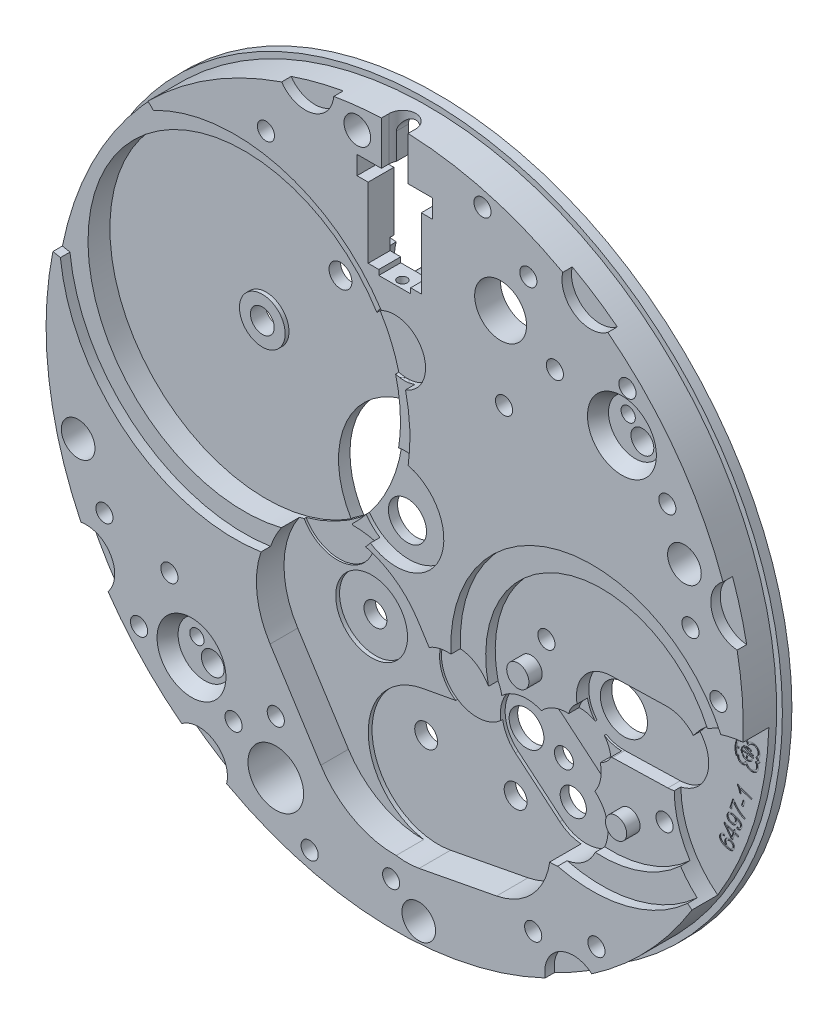
from build123d import *
from OCP.BRepFilletAPI import BRepFilletAPI_MakeChamfer

# Parameters (mm, degrees)
SKETCH2_R           = 18.6
BOSS_EXTRUDE1_DEPTH = 2.25
SKETCH3_OUTSIDE_W   = 49.732
SKETCH3_OUTSIDE_H   = 49.732
SKETCH3_OUTSIDE_R   = 18.3
CUT_EXTRUDE1_DEPTH  = 1.75
CUT_EXTRUDE2_DEPTH  = 1.1
SKETCH41_R          = 0.7
BOSS_EXTRUDE7_DEPTH = 1.1
CUT_EXTRUDE3_DEPTH  = 0.9
SKETCH7_R           = 1.785
CUT_EXTRUDE4_DEPTH  = 0.5
SKETCH12_R          = 2.139
CUT_EXTRUDE8_DEPTH  = 1
SKETCH39_R          = 0.7
BOSS_EXTRUDE5_DEPTH = 1
SKETCH13_R          = 4.396
CUT_EXTRUDE9_DEPTH  = 0.9
SKETCH40_R          = 0.39
BOSS_EXTRUDE6_DEPTH = 0.9
SKETCH14_R          = 0.7
CUT_EXTRUDE10_DEPTH = 0.5
SKETCH15_R          = 4.6
CUT_EXTRUDE11_DEPTH = 0.5
CUT_EXTRUDE19_REACH = 28.4
SKETCH27_R          = 1.286
CUT_EXTRUDE22_DEPTH = 0.9
SKETCH33_R          = 1.275
CUT_EXTRUDE27_DEPTH = 0.7
CUT_EXTRUDE28_REACH = 28.4
SKETCH34_R          = 0.375
SKETCH36_R          = 0.75
BOSS_EXTRUDE4_DEPTH = 0.9
SKETCH37_R          = 0.739
CUT_EXTRUDE29_DEPTH = 1
CUT_EXTRUDE30_REACH = 28.4
SKETCH38_R          = 0.45
SKETCH45_R          = 2.089
CUT_EXTRUDE33_DEPTH = 0.6
CUT_EXTRUDE5_DEPTH  = 1.65
CUT_EXTRUDE6_DEPTH  = 1.65
SKETCH11_R          = 5.024
CUT_EXTRUDE7_DEPTH  = 1.35
SKETCH16_R          = 6.087
CUT_EXTRUDE12_DEPTH = 1
SKETCH21_R          = 1.202
CUT_EXTRUDE16_DEPTH = 1.55
SKETCH18_R          = 8.2
CUT_EXTRUDE13_DEPTH = 1.65
CUT_EXTRUDE31_REACH = 28.4
CUT_EXTRUDE14_DEPTH = 0.5
CUT_EXTRUDE15_DEPTH = 1.45
SKETCH22_R          = 1.87
CUT_EXTRUDE17_DEPTH = 1.55
SKETCH23_R          = 7.42
CUT_EXTRUDE18_DEPTH = 0.5
CUT_EXTRUDE20_START = 15.997
CUT_EXTRUDE20_DEPTH = 2.303
CUT_EXTRUDE21_DEPTH = 1.8
CUT_EXTRUDE23_REACH = 28.4
SKETCH28_R          = 1
SKETCH29_R          = 1.5
CUT_EXTRUDE24_DEPTH = 0.5
SKETCH30_R          = 2
CUT_EXTRUDE25_DEPTH = 1.55
SKETCH31_R          = 1.2
BOSS_EXTRUDE2_DEPTH = 0.2
SKETCH32_R          = 1.405
CUT_EXTRUDE26_DEPTH = 0.7
CHAMFER1_SIZE       = 0.404
CHAMFER1_SIZE_2     = 0.7
SKETCH35_R          = 0.5815
SKETCH35_R_2        = 0.558
BOSS_EXTRUDE3_DEPTH = 0.7
SKETCH48_R          = 2.5
SKETCH48_R_2        = 1.62
CUT_EXTRUDE37_DEPTH = 0.67
SKETCH43_R          = 1.362
SKETCH43_R_2        = 0.45
SKETCH43_R_3        = 0.7
SKETCH43_R_4        = 0.625
SKETCH43_R_5        = 0.912
SKETCH43_R_6        = 0.6875
SKETCH43_R_7        = 1.2365
SKETCH43_R_8        = 1.461
SKETCH43_R_9        = 1
CUT_EXTRUDE32_DEPTH = 27.400426141
SKETCH44_R          = 0.884
SKETCH44_R_2        = 0.6
SKETCH44_R_3        = 0.5
CUT_EXTRUDE34_DEPTH = 27.400426141
CHAMFER2_SIZE       = 0.7
CHAMFER3_SIZE       = 0.7
SKETCH46_R          = 0.45
CUT_EXTRUDE35_DEPTH = 27.400426141
SKETCH47_R          = 0.65
CUT_EXTRUDE36_DEPTH = 0.5
SKETCH50_R          = 0.25
CUT_EXTRUDE38_DEPTH = 4.608
SKETCH51_R          = 0.6
CUT_EXTRUDE39_DEPTH = 27.400426141
SKETCH52_R          = 1.884
CUT_EXTRUDE40_DEPTH = 1.65
CUT_EXTRUDE41_REACH = 28.342
BOSS_EXTRUDE8_DEPTH = 0.05
CUT_EXTRUDE42_REACH = 28.342
CUT_EXTRUDE43_REACH = 28.342
CUT_EXTRUDE44_REACH = 28.342
CUT_EXTRUDE45_DEPTH = 0.05


with BuildPart() as part:
    # Sketch2 → Boss-Extrude1 (new body)
    with BuildSketch(Plane.XY):
        Circle(SKETCH2_R)
    extrude(amount=-BOSS_EXTRUDE1_DEPTH)

    # Sketch3 outside → Cut-Extrude1 (cut)
    with BuildSketch(Plane.XY):
        Rectangle(SKETCH3_OUTSIDE_W, SKETCH3_OUTSIDE_H)
        Circle(SKETCH3_OUTSIDE_R, mode=Mode.SUBTRACT)
    extrude(amount=-CUT_EXTRUDE1_DEPTH, mode=Mode.SUBTRACT)

    # Sketch5 → Cut-Extrude2 (cut)
    with BuildSketch(Plane(origin=(0, 0, -2.25), x_dir=(-1, 0, 0), z_dir=(0, 0, -1))):
        with BuildLine():
            Line((-0.625, 17.375), (-0.625, 11.941))
            Line((-0.625, 11.941), (-1.393240826, 11.941))
            ThreePointArc((-1.393240826, 11.941), (0, 7.897), (1.393240826, 11.941))
            Line((1.393240826, 11.941), (0.625, 11.941))
            Line((0.625, 11.941), (0.625, 17.375))
            ThreePointArc((0.625, 17.375), (0, 18), (-0.625, 17.375))
        make_face()
    extrude(amount=-CUT_EXTRUDE2_DEPTH, mode=Mode.SUBTRACT)

    # Sketch41 → Boss-Extrude7 (add)
    with BuildSketch(Plane(origin=(0, 0, -1.15), x_dir=(-1, 0, 0), z_dir=(0, 0, -1))):
        with Locations((0, 10.159)):
            Circle(SKETCH41_R)
    extrude(amount=BOSS_EXTRUDE7_DEPTH)

    # Sketch6 → Cut-Extrude3 (cut)
    with BuildSketch(Plane(origin=(0, 0, -2.25), x_dir=(-1, 0, 0), z_dir=(0, 0, -1))):
        with BuildLine():
            Line((-2.076890078, 15.421423569), (-5.927172387, 13.552408211))
            ThreePointArc((-5.927172387, 13.552408211), (-6.035449278, 14.182114052), (-6.291785685, 14.767387473))
            ThreePointArc((-6.291785685, 14.767387473), (-7.133886391, 14.194789294), (-7.748340733, 15.006853415))
            ThreePointArc((-7.748340733, 15.006853415), (-10.14098996, 14.254732917), (-9.41173086, 11.855016948))
            ThreePointArc((-9.41173086, 11.855016948), (-10.4299638, 9.379413114), (-7.917626481, 8.455522506))
            Line((-7.917626481, 8.455522506), (-0.737336458, 11.941))
            Line((-0.737336458, 11.941), (0.422162218, 11.941))
            ThreePointArc((0.422162218, 11.941), (1.70564449, 10.838656818), (3.338835421, 11.280442527))
            ThreePointArc((3.338835421, 11.280442527), (4.540703411, 12.185954627), (5.905433906, 12.819949505))
            ThreePointArc((5.905433906, 12.819949505), (6.700320393, 13.301781919), (7.221300042, 14.07157878))
            ThreePointArc((7.221300042, 14.07157878), (7.507306005, 14.567751633), (7.362177948, 15.121759538))
            ThreePointArc((7.362177948, 15.121759538), (6.983377806, 16.123181813), (6.172512816, 16.822348523))
            ThreePointArc((6.172512816, 16.822348523), (3.717993414, 17.734315655), (1.125774471, 18.104113573))
            ThreePointArc((1.125774471, 18.104113573), (0.264750255, 18.014470296), (-0.538988303, 17.69290701))
            ThreePointArc((-0.538988303, 17.69290701), (-2.392928729, 17.291754548), (-2.076890078, 15.421423569))
        make_face()
    extrude(amount=-CUT_EXTRUDE3_DEPTH, mode=Mode.SUBTRACT)

    # Sketch7 → Cut-Extrude4 (cut)
    with BuildSketch(Plane(origin=(0, 0, -2.25), x_dir=(-1, 0, 0), z_dir=(0, 0, -1))):
        with Locations((-10.179, 11.074)):
            Circle(SKETCH7_R)
    extrude(amount=-CUT_EXTRUDE4_DEPTH, mode=Mode.SUBTRACT)

    # Sketch12 → Cut-Extrude8 (cut)
    with BuildSketch(Plane(origin=(0, 0, -2.25), x_dir=(-1, 0, 0), z_dir=(0, 0, -1))):
        with Locations((-2.56, 7.678)):
            Circle(SKETCH12_R)
    extrude(amount=-CUT_EXTRUDE8_DEPTH, mode=Mode.SUBTRACT)

    # Sketch39 → Boss-Extrude5 (add)
    with BuildSketch(Plane(origin=(0, 0, -1.25), x_dir=(-1, 0, 0), z_dir=(0, 0, -1))):
        with Locations(Location((-2.56, 7.678, 0), (0, 0, 180))):
            Circle(SKETCH39_R)
    extrude(amount=BOSS_EXTRUDE5_DEPTH)

    # Sketch13 → Cut-Extrude9 (cut)
    with BuildSketch(Plane(origin=(0, 0, -2.25), x_dir=(-1, 0, 0), z_dir=(0, 0, -1))):
        with Locations((-4.61, 2.397)):
            Circle(SKETCH13_R)
    extrude(amount=-CUT_EXTRUDE9_DEPTH, mode=Mode.SUBTRACT)

    # Sketch40 → Boss-Extrude6 (add)
    with BuildSketch(Plane(origin=(0, 0, -1.35), x_dir=(-1, 0, 0), z_dir=(0, 0, -1))):
        with Locations((-4.61, 2.397)):
            Circle(SKETCH40_R)
    extrude(amount=BOSS_EXTRUDE6_DEPTH)

    # Sketch14 → Cut-Extrude10 (cut)
    with BuildSketch(Plane(origin=(0, 0, -2.25), x_dir=(-1, 0, 0), z_dir=(0, 0, -1))):
        with BuildLine():
            Line((-3.076249804, 10.805637807), (-1.90914891, 11.372175354))
            ThreePointArc((-1.90914891, 11.372175354), (-2.122650137, 10.940665144), (-2.239995369, 10.473745524))
            ThreePointArc((-2.239995369, 10.473745524), (0.243499976, 7.435134023), (-2.725542979, 4.86887353))
            ThreePointArc((-2.725542979, 4.86887353), (-8.591624788, 5.723803536), (-6.589517741, 11.303533679))
            ThreePointArc((-6.589517741, 11.303533679), (-7.667655819, 12.642680547), (-7.481667895, 14.351804456))
            ThreePointArc((-7.481667895, 14.351804456), (-6.517059725, 14.377034404), (-6.399706667, 15.334809812))
            ThreePointArc((-6.399706667, 15.334809812), (-3.533544819, 14.328146092), (-4.296817174, 11.387793919))
            ThreePointArc((-4.296817174, 11.387793919), (-3.660629892, 11.151026184), (-3.076249804, 10.805637807))
        make_face()
        with Locations(Location((-2.56, 7.678, 0), (0, 0, 180))):
            Circle(SKETCH14_R, mode=Mode.SUBTRACT)
    extrude(amount=-CUT_EXTRUDE10_DEPTH, mode=Mode.SUBTRACT)

    # Sketch15 → Cut-Extrude11 (cut)
    with BuildSketch(Plane(origin=(0, 0, -2.25), x_dir=(-1, 0, 0), z_dir=(0, 0, -1))):
        Circle(SKETCH15_R)
    extrude(amount=-CUT_EXTRUDE11_DEPTH, mode=Mode.SUBTRACT)

    # Sketch24 → Cut-Extrude19 (cut, up to next)
    with BuildSketch(Plane(origin=(0, 0, -2.25), x_dir=(-1, 0, 0), z_dir=(0, 0, -1)), mode=Mode.PRIVATE) as cut_extrude19_sk1:
        with BuildLine():
            Line((-0.625, 17.375), (-0.625, 15.997))
            Line((-0.625, 15.997), (-1.9775, 15.997))
            Line((-1.9775, 15.997), (-1.9775, 15.026))
            Line((-1.9775, 15.026), (-1.3935, 15.026))
            Line((-1.3935, 15.026), (-1.3935, 11.336))
            Line((-1.3935, 11.336), (-0.8345, 11.336))
            Line((-0.8345, 11.336), (-0.8345, 11.064))
            Line((-0.8345, 11.064), (0.8345, 11.064))
            Line((0.8345, 11.064), (0.8345, 11.336))
            Line((0.8345, 11.336), (1.3935, 11.336))
            Line((1.3935, 11.336), (1.3935, 15.026))
            Line((1.3935, 15.026), (1.9775, 15.026))
            Line((1.9775, 15.026), (1.9775, 15.997))
            Line((1.9775, 15.997), (0.625, 15.997))
            Line((0.625, 15.997), (0.625, 17.375))
            ThreePointArc((0.625, 17.375), (0, 18), (-0.625, 17.375))
        make_face()
    cut_extrude19_tool1 = extrude(cut_extrude19_sk1.sketch, amount=-CUT_EXTRUDE19_REACH, mode=Mode.PRIVATE) & part.part
    add(cut_extrude19_tool1.solids().sort_by_distance((0, 14.175659, -2.25))[0], mode=Mode.SUBTRACT)

    # Sketch27 → Cut-Extrude22 (cut)
    with BuildSketch(Plane(origin=(0, 0, -2.25), x_dir=(-1, 0, 0), z_dir=(0, 0, -1))):
        with Locations((-5.514, 13.273)):
            Circle(SKETCH27_R)
    extrude(amount=-CUT_EXTRUDE22_DEPTH, mode=Mode.SUBTRACT)

    # Sketch33 → Cut-Extrude27 (cut)
    with BuildSketch(Plane(origin=(0, 0, -2.25), x_dir=(-1, 0, 0), z_dir=(0, 0, -1))):
        with Locations((-11.554, 10.605)):
            Circle(SKETCH33_R)
        with Locations((11.084, -10.828)):
            Circle(SKETCH33_R)
    extrude(amount=-CUT_EXTRUDE27_DEPTH, mode=Mode.SUBTRACT)

    # Sketch34 → Cut-Extrude28 (cut, up to next)
    with BuildSketch(Plane(origin=(0, 0, -2.25), x_dir=(-1, 0, 0), z_dir=(0, 0, -1)), mode=Mode.PRIVATE) as cut_extrude28_sk1:
        with Locations((-11.554, 10.605)):
            Circle(SKETCH34_R)
    cut_extrude28_tool1 = extrude(cut_extrude28_sk1.sketch, amount=-CUT_EXTRUDE28_REACH, mode=Mode.PRIVATE) & part.part
    # Sketch34 → Cut-Extrude28 (cut, up to next)
    with BuildSketch(Plane(origin=(0, 0, -2.25), x_dir=(-1, 0, 0), z_dir=(0, 0, -1)), mode=Mode.PRIVATE) as cut_extrude28_sk2:
        with Locations((11.084, -10.828)):
            Circle(SKETCH34_R)
    cut_extrude28_tool2 = extrude(cut_extrude28_sk2.sketch, amount=-CUT_EXTRUDE28_REACH, mode=Mode.PRIVATE) & part.part
    add(cut_extrude28_tool1.solids().sort_by_distance((11.554, 10.605, -2.25))[0], mode=Mode.SUBTRACT)
    add(cut_extrude28_tool2.solids().sort_by_distance((-11.084, -10.828, -2.25))[0], mode=Mode.SUBTRACT)

    # Sketch36 → Boss-Extrude4 (add)
    with BuildSketch(Plane(origin=(0, 0, -2.25), x_dir=(-1, 0, 0), z_dir=(0, 0, -1))):
        with Locations((-8.565, 13.423)):
            Circle(SKETCH36_R)
    extrude(amount=-BOSS_EXTRUDE4_DEPTH)

    # Sketch37 → Cut-Extrude29 (cut)
    with BuildSketch(Plane(origin=(0, 0, -2.25), x_dir=(-1, 0, 0), z_dir=(0, 0, -1))):
        with Locations((-7.014, 14.924)):
            Circle(SKETCH37_R)
    extrude(amount=-CUT_EXTRUDE29_DEPTH, mode=Mode.SUBTRACT)

    # Sketch38 → Cut-Extrude30 (cut, up to next)
    with BuildSketch(Plane(origin=(0, 0, -2.25), x_dir=(-1, 0, 0), z_dir=(0, 0, -1)), mode=Mode.PRIVATE) as cut_extrude30_sk1:
        with Locations((-7.014, 14.924)):
            Circle(SKETCH38_R)
    cut_extrude30_tool1 = extrude(cut_extrude30_sk1.sketch, amount=-CUT_EXTRUDE30_REACH, mode=Mode.PRIVATE) & part.part
    add(cut_extrude30_tool1.solids().sort_by_distance((7.014, 14.924, -2.25))[0], mode=Mode.SUBTRACT)

    # Sketch45 → Cut-Extrude33 (cut)
    with BuildSketch(Plane(origin=(0, 0, -1.75), x_dir=(-1, 0, 0), z_dir=(0, 0, -1))):
        with Locations((0.232, 0.114)):
            Circle(SKETCH45_R)
    extrude(amount=-CUT_EXTRUDE33_DEPTH, mode=Mode.SUBTRACT)

    # Sketch9 → Cut-Extrude5 (cut)
    with BuildSketch(Plane.XY):
        with BuildLine():
            Line((1.28197439, -14.832200316), (5.34897439, -14.054200316))
            ThreePointArc((5.34897439, -14.054200316), (7.104703788, -13.144772192), (8.078658765, -11.424))
            ThreePointArc((8.078658765, -11.424), (8.110145994, -11.271567283), (8.134765721, -11.117875879))
            ThreePointArc((8.134765721, -11.117875879), (10.054091894, -9.912691286), (9.511131814, -7.712355582))
            ThreePointArc((9.511131814, -7.712355582), (9.80536714, -7.021819052), (9.793277303, -6.271306586))
            ThreePointArc((9.793277303, -6.271306586), (9.236753092, -5.252231098), (8.139268411, -4.873072265))
            ThreePointArc((8.139268411, -4.873072265), (7.355220259, -5.002491984), (6.702735397, -5.456082629))
            ThreePointArc((6.702735397, -5.456082629), (5.608858257, -5.321849251), (4.619263756, -5.806914735))
            ThreePointArc((4.619263756, -5.806914735), (3.802175085, -7.685286504), (1.753783598, -7.68787791))
            Line((1.753783598, -7.68787791), (0, -8.011669418))
            ThreePointArc((0, -8.011669418), (-2.780283148, -12.064990522), (1.28197439, -14.832200316))
        make_face()
    extrude(amount=-CUT_EXTRUDE5_DEPTH, mode=Mode.SUBTRACT)

    # Sketch10 → Cut-Extrude6 (cut)
    with BuildSketch(Plane.XY):
        with BuildLine():
            Line((10.429783108, -5.725354257), (13.337783108, -5.648354257))
            ThreePointArc((13.337783108, -5.648354257), (15.131354257, -3.757216892), (13.240216892, -1.963645743))
            Line((13.240216892, -1.963645743), (10.332216892, -2.040645743))
            ThreePointArc((10.332216892, -2.040645743), (8.538645743, -3.931783108), (10.429783108, -5.725354257))
        make_face()
    extrude(amount=-CUT_EXTRUDE6_DEPTH, mode=Mode.SUBTRACT)

    # Sketch11 → Cut-Extrude7 (cut)
    with BuildSketch(Plane.XY):
        with Locations((18.697, -5.603)):
            Circle(SKETCH11_R)
    extrude(amount=-CUT_EXTRUDE7_DEPTH, mode=Mode.SUBTRACT)

    # Sketch16 → Cut-Extrude12 (cut)
    with BuildSketch(Plane.XY):
        with Locations((10.363, -3.905)):
            Circle(SKETCH16_R)
    extrude(amount=-CUT_EXTRUDE12_DEPTH, mode=Mode.SUBTRACT)

    # Sketch21 → Cut-Extrude16 (cut)
    with BuildSketch(Plane.XY):
        with Locations((9.294, -5.176)):
            Circle(SKETCH21_R)
    extrude(amount=-CUT_EXTRUDE16_DEPTH, mode=Mode.SUBTRACT)

    # Sketch18 → Cut-Extrude13 (cut)
    with BuildSketch(Plane.XY):
        with Locations((-8.4, 4.5)):
            Circle(SKETCH18_R)
    extrude(amount=-CUT_EXTRUDE13_DEPTH, mode=Mode.SUBTRACT)

    # Sketch42 → Cut-Extrude31 (cut, up to next)
    with BuildSketch(Plane.XY, mode=Mode.PRIVATE) as cut_extrude31_sk1:
        with BuildLine():
            ThreePointArc((-3.937004344, -2.379074776), (-1.171864246, 0.627784417), (-0.200557598, 4.595625817))
            ThreePointArc((-0.200557598, 4.595625817), (-4.054807862, 2.172218498), (-3.937004344, -2.379074776))
        make_face()
    cut_extrude31_tool1 = extrude(cut_extrude31_sk1.sketch, amount=-CUT_EXTRUDE31_REACH, mode=Mode.PRIVATE) & part.part
    add(cut_extrude31_tool1.solids().sort_by_distance((-2.52901, 1.354827, 0))[0], mode=Mode.SUBTRACT)

    # Sketch19 → Cut-Extrude14 (cut)
    with BuildSketch(Plane.XY):
        with BuildLine():
            Line((-12.949749453, 12.930351468), (-12.668984942, 12.649586957))
            ThreePointArc((-12.668984942, 12.649586957), (-0.28543724, 0.16481013), (-17.547453856, 3.518120199))
            Line((-17.547453856, 3.518120199), (-17.942782165, 3.598133986))
            ThreePointArc((-17.942782165, 3.598133986), (-16.13566541, 8.633093407), (-12.949749453, 12.930351468))
        make_face()
    extrude(amount=-CUT_EXTRUDE14_DEPTH, mode=Mode.SUBTRACT)

    # Sketch20 → Cut-Extrude15 (cut)
    with BuildSketch(Plane.XY):
        with BuildLine():
            Line((1.216929316, -3.601368333), (3.878929316, -7.777368333))
            ThreePointArc((3.878929316, -7.777368333), (2.472631667, -14.128929316), (-3.878929316, -12.722631667))
            Line((-3.878929316, -12.722631667), (-6.540929316, -8.546631667))
            ThreePointArc((-6.540929316, -8.546631667), (-5.134631667, -2.195070684), (1.216929316, -3.601368333))
        make_face()
    extrude(amount=-CUT_EXTRUDE15_DEPTH, mode=Mode.SUBTRACT)

    # Sketch22 → Cut-Extrude17 (cut)
    with BuildSketch(Plane.XY):
        with Locations((2.776, -6.122)):
            Circle(SKETCH22_R)
    extrude(amount=-CUT_EXTRUDE17_DEPTH, mode=Mode.SUBTRACT)

    # Sketch23 → Cut-Extrude18 (cut)
    with BuildSketch(Plane.XY):
        with Locations((10.363, -3.905)):
            Circle(SKETCH23_R)
    extrude(amount=-CUT_EXTRUDE18_DEPTH, mode=Mode.SUBTRACT)

    # Sketch25 → Cut-Extrude20 (cut)
    with BuildSketch(Plane(origin=(0, 0, 0), x_dir=(1, 0, 0), z_dir=(0, 1, 0)).offset(CUT_EXTRUDE20_START)):
        with BuildLine():
            Line((-0.7, 0.4), (-0.7, -1.346245717))
            Line((-0.7, -1.346245717), (0.7, -1.346245717))
            Line((0.7, -1.346245717), (0.7, 0.4))
            ThreePointArc((0.7, 0.4), (0, 1.1), (-0.7, 0.4))
        make_face()
    extrude(amount=CUT_EXTRUDE20_DEPTH, mode=Mode.SUBTRACT)

    # Sketch26 → Cut-Extrude21 (cut)
    with BuildSketch(Plane.XY):
        with BuildLine():
            Line((7.174290963, -5.748427138), (9.505290963, -7.707427138))
            ThreePointArc((9.505290963, -7.707427138), (9.741572862, -10.432290963), (7.016709037, -10.668572862))
            Line((7.016709037, -10.668572862), (4.685709037, -8.709572862))
            ThreePointArc((4.685709037, -8.709572862), (4.449427138, -5.984709037), (7.174290963, -5.748427138))
        make_face()
    extrude(amount=-CUT_EXTRUDE21_DEPTH, mode=Mode.SUBTRACT)

    # Sketch28 → Cut-Extrude23 (cut, up to next)
    with BuildSketch(Plane.XY, mode=Mode.PRIVATE) as cut_extrude23_sk1:
        with Locations((5.076502439, -18.62039535)):
            Circle(SKETCH28_R)
    cut_extrude23_tool1 = extrude(cut_extrude23_sk1.sketch, amount=-CUT_EXTRUDE23_REACH, mode=Mode.PRIVATE) & part.part
    add(cut_extrude23_tool1.solids().sort_by_distance((5.076502, -18.620395, 0))[0], mode=Mode.SUBTRACT)

    # Sketch29 → Cut-Extrude24 (cut)
    with BuildSketch(Plane.XY):
        with Locations((-16.196915723, -9.44576207)):
            Circle(SKETCH29_R)
        with Locations((-10.280498053, -15.680365422)):
            Circle(SKETCH29_R)
        with Locations((-4.694625076, 18.152768257)):
            Circle(SKETCH29_R)
        with Locations((10.280498053, 15.680365422)):
            Circle(SKETCH29_R)
        with Locations((18.089762322, 4.931835271)):
            Circle(SKETCH29_R)
        with Locations((9.375, -16.237976321)):
            Circle(SKETCH29_R)
    extrude(amount=-CUT_EXTRUDE24_DEPTH, mode=Mode.SUBTRACT)

    # Sketch30 → Cut-Extrude25 (cut)
    with BuildSketch(Plane.XY):
        with Locations((-4.465, -2.41)):
            Circle(SKETCH30_R)
    extrude(amount=-CUT_EXTRUDE25_DEPTH, mode=Mode.SUBTRACT)

    # Sketch31 → Boss-Extrude2 (add)
    with BuildSketch(Plane.XY.offset(-1.65)):
        with Locations((-8.4, 4.5)):
            Circle(SKETCH31_R)
    extrude(amount=BOSS_EXTRUDE2_DEPTH)

    # Sketch32 → Cut-Extrude26 (cut)
    with BuildSketch(Plane.XY):
        with Locations((-10.667, -11.224)):
            Circle(SKETCH32_R)
        with Locations((11.927, 10.167)):
            Circle(SKETCH32_R)
    extrude(amount=-CUT_EXTRUDE26_DEPTH, mode=Mode.SUBTRACT)

    # Chamfer1
    chamfer1_edges_1 = [part.edges().sort_by_distance(p)[0] for p in [
        (10.522, 10.167, 0),
    ]]
    chamfer1_side_1 = [part.faces().sort_by_distance(p)[0] for p in [
        (10.51392, 10.167, 0),
    ]]
    chamfer1_edges_2 = [part.edges().sort_by_distance(p)[0] for p in [
        (-12.072, -11.224, 0),
    ]]
    chamfer1_side_2 = [part.faces().sort_by_distance(p)[0] for p in [
        (-12.08008, -11.224, 0),
    ]]
    chamfer1 = BRepFilletAPI_MakeChamfer(part.part.solid().wrapped)
    for e in chamfer1_edges_1:
        chamfer1.Add(CHAMFER1_SIZE - 0.0001, CHAMFER1_SIZE_2 - 0.0001, e.wrapped, chamfer1_side_1[0].wrapped)
    for e in chamfer1_edges_2:
        chamfer1.Add(CHAMFER1_SIZE - 0.0001, CHAMFER1_SIZE_2 - 0.0001, e.wrapped, chamfer1_side_2[0].wrapped)
    add(Compound.cast(chamfer1.Shape()), mode=Mode.REPLACE)  # a hair under: the kernel refuses the full size

    # Sketch35 → Boss-Extrude3 (add)
    with BuildSketch(Plane.XY.offset(-1)):
        with Locations((6.161, -3.782)):
            Circle(SKETCH35_R)
        with Locations((11.32, -8.118)):
            Circle(SKETCH35_R_2)
    extrude(amount=BOSS_EXTRUDE3_DEPTH)

    # Sketch48 → Cut-Extrude37 (cut)
    with BuildSketch(Plane.XY):
        with Locations((0.078, 0.778)):
            Circle(SKETCH48_R)
        with Locations((0, 8.078)):
            Circle(SKETCH48_R_2)
    extrude(amount=-CUT_EXTRUDE37_DEPTH, mode=Mode.SUBTRACT)

    # Sketch43 → Cut-Extrude32 (cut, through all)
    with BuildSketch(Plane.XY):
        with Locations((5.559, 12.665)):
            Circle(SKETCH43_R)
        with Locations((5.74, 8.443)):
            Circle(SKETCH43_R_2)
        with Locations((-1.962, 17.101)):
            Circle(SKETCH43_R_3)
        with Locations((8.406, 11.401)):
            Circle(SKETCH43_R_2)
        with Locations((-6.76, 14.668)):
            Circle(SKETCH43_R_2)
        with Locations((-8.4, 4.5)):
            Circle(SKETCH43_R_4)
        with Locations((5.118, -7.436)):
            Circle(SKETCH43_R_5)
        with Locations((7.573, -9.565)):
            Circle(SKETCH43_R_6)
        with Locations((10.381, -3.883)):
            Circle(SKETCH43_R_7)
        with Locations((-6.242, -14.488)):
            Circle(SKETCH43_R_8)
        Circle(SKETCH43_R_9)
        with Locations((6.963, -2.083)):
            Circle(SKETCH43_R_2)
        with Locations((13.163, -7.277)):
            Circle(SKETCH43_R_2)
    extrude(amount=-CUT_EXTRUDE32_DEPTH, mode=Mode.SUBTRACT)

    # Sketch44 → Cut-Extrude34 (cut, through all)
    with BuildSketch(Plane.XY):
        with Locations((15.207, 5.962)):
            Circle(SKETCH44_R)
        with Locations((1.261, -17.245)):
            Circle(SKETCH44_R)
        with Locations((-16.617, -4.254)):
            Circle(SKETCH44_R)
        with Locations((12.3, 9.73)):
            Circle(SKETCH44_R_2)
        with Locations((-10.25, -11.62)):
            Circle(SKETCH44_R_2)
        with Locations((-4.496, 8.404)):
            Circle(SKETCH44_R_2)
        with Locations((0, -10.25)):
            Circle(SKETCH44_R_2)
        with Locations((4.697, -10.646)):
            Circle(SKETCH44_R_2)
        with Locations((7.084, -7.805)):
            Circle(SKETCH44_R_3)
    extrude(amount=-CUT_EXTRUDE34_DEPTH, mode=Mode.SUBTRACT)

    # Chamfer2
    chamfer2_edges = [part.edges().sort_by_distance(p)[0] for p in [
        (12.495848347, 9.162863839, -2.25),
    ]]
    chamfer(chamfer2_edges, length=CHAMFER2_SIZE)

    # Chamfer3
    chamfer3_edges = [part.edges().sort_by_distance(p)[0] for p in [
        (-10.024728421, -12.17610495, -2.25),
    ]]
    chamfer(chamfer3_edges, length=CHAMFER3_SIZE)

    # Sketch46 → Cut-Extrude35 (cut, through all)
    with BuildSketch(Plane.XY):
        with Locations((4.607, 16.888)):
            Circle(SKETCH46_R)
        with Locations((12.216, 12.456)):
            Circle(SKETCH46_R)
        with Locations((14.31, 8.246)):
            Circle(SKETCH46_R)
        with Locations((15.525, 3.231)):
            Circle(SKETCH46_R)
        with Locations((16.991, 0.612)):
            Circle(SKETCH46_R)
        with Locations((10.588, -13.74)):
            Circle(SKETCH46_R)
        with Locations((7.269, -14.7)):
            Circle(SKETCH46_R)
        with Locations((-0.188, -16.038)):
            Circle(SKETCH46_R)
        with Locations((-4.466, -16.879)):
            Circle(SKETCH46_R)
        with Locations((-6.242, -11.68)):
            Circle(SKETCH46_R)
        with Locations((-8.46, -13.019)):
            Circle(SKETCH46_R)
        with Locations((-13.42, -11.18)):
            Circle(SKETCH46_R)
        with Locations((-11.827, -7.953)):
            Circle(SKETCH46_R)
        with Locations((-15.237, -6.934)):
            Circle(SKETCH46_R)
    extrude(amount=-CUT_EXTRUDE35_DEPTH, mode=Mode.SUBTRACT)

    # Sketch47 → Cut-Extrude36 (cut)
    with BuildSketch(Plane(origin=(0, 0, -2.25), x_dir=(-1, 0, 0), z_dir=(0, 0, -1))):
        with Locations((-4.607, 16.888)):
            Circle(SKETCH47_R)
        with Locations((-12.216, 12.456)):
            Circle(SKETCH47_R)
        with Locations((-14.31, 8.246)):
            Circle(SKETCH47_R)
        with Locations((-15.525, 3.231)):
            Circle(SKETCH47_R)
        with Locations((-16.991, 0.612)):
            Circle(SKETCH47_R)
        with Locations((-10.588, -13.74)):
            Circle(SKETCH47_R)
        with Locations((-7.269, -14.7)):
            Circle(SKETCH47_R)
        with Locations((0.188, -16.038)):
            Circle(SKETCH47_R)
        with Locations((4.466, -16.879)):
            Circle(SKETCH47_R)
        with Locations((6.242, -11.68)):
            Circle(SKETCH47_R)
        with Locations((8.46, -13.019)):
            Circle(SKETCH47_R)
        with Locations((13.42, -11.18)):
            Circle(SKETCH47_R)
        with Locations((11.827, -7.953)):
            Circle(SKETCH47_R)
        with Locations((15.237, -6.934)):
            Circle(SKETCH47_R)
    extrude(amount=-CUT_EXTRUDE36_DEPTH, mode=Mode.SUBTRACT)

    # Sketch50 → Cut-Extrude38 (cut)
    with BuildSketch(Plane(origin=(0, 11.064, 0), x_dir=(1, 0, 0), z_dir=(0, 1, 0))):
        with Locations(Location((0, 0.403811618, 0), (0, 0, 270))):
            Circle(SKETCH50_R)
    extrude(amount=-CUT_EXTRUDE38_DEPTH, mode=Mode.SUBTRACT)

    # Sketch51 → Cut-Extrude39 (cut, through all)
    with BuildSketch(Plane.XY):
        with Locations((-2.662, -6.074)):
            Circle(SKETCH51_R)
    extrude(amount=-CUT_EXTRUDE39_DEPTH, mode=Mode.SUBTRACT)

    # Sketch52 → Cut-Extrude40 (cut)
    with BuildSketch(Plane.XY):
        with Locations((-2.662, -6.074)):
            Circle(SKETCH52_R)
    extrude(amount=-CUT_EXTRUDE40_DEPTH, mode=Mode.SUBTRACT)

    # Sketch53 → Cut-Extrude41 (cut, up to next)
    with BuildSketch(Plane(origin=(0, 0, -1.4), x_dir=(-1, 0, 0), z_dir=(0, 0, -1)), mode=Mode.PRIVATE) as cut_extrude41_sk1:
        with BuildLine():
            Line((-16.64629511, -2.698465392), (-16.565968327, -2.727196198))
            ThreePointArc((-16.565968327, -2.727196198), (-16.521669013, -2.272222759), (-16.674720485, -1.841480949))
            Line((-16.674720485, -1.841480949), (-16.745710608, -1.888791136))
            ThreePointArc((-16.745710608, -1.888791136), (-16.958042942, -1.683722474), (-17.22235716, -1.815161321))
            ThreePointArc((-17.22235716, -1.815161321), (-17.714250431, -1.809285326), (-17.73087182, -2.300932808))
            Line((-17.73087182, -2.300932808), (-17.834368044, -2.433401933))
            Line((-17.834368044, -2.433401933), (-17.701898918, -2.536898157))
            ThreePointArc((-17.701898918, -2.536898157), (-17.566830964, -3.009920529), (-17.090970558, -2.885219324))
            ThreePointArc((-17.090970558, -2.885219324), (-16.802709667, -2.948810478), (-16.64629511, -2.698465392))
        make_face()
    cut_extrude41_tool1 = extrude(cut_extrude41_sk1.sketch, amount=-CUT_EXTRUDE41_REACH, mode=Mode.PRIVATE) & part.part
    add(cut_extrude41_tool1.solids().sort_by_distance((17.181047, -2.353184, -1.4))[0], mode=Mode.SUBTRACT)

    # Sketch55 → Boss-Extrude8 (add)
    with BuildSketch(Plane.XY.offset(-1.35)):
        with BuildLine():
            Line((16.631824556, -2.610968404), (16.76232756, -2.626992158))
            ThreePointArc((16.76232756, -2.626992158), (16.747267128, -2.664195316), (16.740645477, -2.70378124))
            ThreePointArc((16.740645477, -2.70378124), (16.873123936, -2.871706206), (17.055961074, -2.760711082))
            Line((17.055961074, -2.760711082), (17.144347989, -2.771563631))
            ThreePointArc((17.144347989, -2.771563631), (17.523564982, -2.925770542), (17.571099293, -2.519167802))
            Line((17.571099293, -2.519167802), (17.711310192, -2.418292329))
            Line((17.711310192, -2.418292329), (17.599668142, -2.286493201))
            ThreePointArc((17.599668142, -2.286493201), (17.651911908, -1.88046871), (17.246653253, -1.938354123))
            Line((17.246653253, -1.938354123), (17.158266338, -1.927501575))
            ThreePointArc((17.158266338, -1.927501575), (17.007712395, -1.775571173), (16.838544386, -1.906458611))
            ThreePointArc((16.838544386, -1.906458611), (16.835392644, -1.946470585), (16.841005459, -1.986212099))
            Line((16.841005459, -1.986212099), (16.710502455, -1.970188345))
            ThreePointArc((16.710502455, -1.970188345), (16.656797516, -2.099710932), (16.622606581, -2.235693654))
            Line((16.622606581, -2.235693654), (16.740234773, -2.25013658))
            Line((16.740234773, -2.25013658), (16.728399306, -2.346528727))
            Line((16.728399306, -2.346528727), (16.610771114, -2.332085801))
            ThreePointArc((16.610771114, -2.332085801), (16.611049233, -2.472300791), (16.631824556, -2.610968404))
        make_face()
    extrude(amount=-BOSS_EXTRUDE8_DEPTH)

    # Sketch57 → Cut-Extrude42 (cut, up to next)
    with BuildSketch(Plane(origin=(0, 0, -1.4), x_dir=(-1, 0, 0), z_dir=(0, 0, -1)), mode=Mode.PRIVATE) as cut_extrude42_sk1:
        with BuildLine():
            Line((-17.393950597, -2.123107044), (-17.347876164, -2.168299187))
            ThreePointArc((-17.347876164, -2.168299187), (-17.291323257, -2.124628006), (-17.22503679, -2.097953906))
            Line((-17.22503679, -2.097953906), (-17.212919235, -2.196643474))
            ThreePointArc((-17.212919235, -2.196643474), (-17.338757912, -2.229611082), (-17.468249072, -2.242031841))
            ThreePointArc((-17.468249072, -2.242031841), (-17.477310109, -2.272085496), (-17.483431332, -2.302872753))
            ThreePointArc((-17.483431332, -2.302872753), (-17.195100974, -2.254766748), (-16.938889719, -2.114038725))
            ThreePointArc((-16.938889719, -2.114038725), (-17.168271079, -2.025691061), (-17.393950597, -2.123107044))
        make_face()
        with BuildLine():
            Line((-17.165484021, -2.090641746), (-17.155158185, -2.174738936))
            ThreePointArc((-17.155158185, -2.174738936), (-17.100002919, -2.148066296), (-17.047016746, -2.117309208))
            ThreePointArc((-17.047016746, -2.117309208), (-17.104672929, -2.096973467), (-17.165484021, -2.090641746))
        make_face(mode=Mode.SUBTRACT)
    cut_extrude42_tool1 = extrude(cut_extrude42_sk1.sketch, amount=-CUT_EXTRUDE42_REACH, mode=Mode.PRIVATE) & part.part
    add(cut_extrude42_tool1.solids().sort_by_distance((17.204161, -2.154583, -1.4))[0], mode=Mode.SUBTRACT)

    # Sketch58 → Cut-Extrude43 (cut, up to next)
    with BuildSketch(Plane(origin=(0, 0, -1.4), x_dir=(-1, 0, 0), z_dir=(0, 0, -1)), mode=Mode.PRIVATE) as cut_extrude43_sk1:
        with BuildLine():
            Line((-17.479663405, -2.419438972), (-16.901147944, -2.348406205))
            ThreePointArc((-16.901147944, -2.348406205), (-16.906309207, -2.402489047), (-16.922569502, -2.45432721))
            Line((-16.922569502, -2.45432721), (-16.863338016, -2.479955597))
            ThreePointArc((-16.863338016, -2.479955597), (-16.839022481, -2.311188865), (-16.903444108, -2.153317687))
            Line((-16.903444108, -2.153317687), (-16.954716098, -2.192514195))
            ThreePointArc((-16.954716098, -2.192514195), (-16.926398016, -2.238878821), (-16.908306242, -2.290106549))
            Line((-16.908306242, -2.290106549), (-17.486821703, -2.361139316))
            ThreePointArc((-17.486821703, -2.361139316), (-17.484561533, -2.390451094), (-17.479663405, -2.419438972))
        make_face()
    cut_extrude43_tool1 = extrude(cut_extrude43_sk1.sketch, amount=-CUT_EXTRUDE43_REACH, mode=Mode.PRIVATE) & part.part
    add(cut_extrude43_tool1.solids().sort_by_distance((17.079409, -2.340705, -1.4))[0], mode=Mode.SUBTRACT)

    # Sketch59 → Cut-Extrude44 (cut, up to next)
    with BuildSketch(Plane(origin=(0, 0, -1.4), x_dir=(-1, 0, 0), z_dir=(0, 0, -1)), mode=Mode.PRIVATE) as cut_extrude44_sk1:
        with BuildLine():
            Line((-17.102685527, -2.604685254), (-17.121219986, -2.453734196))
            Line((-17.121219986, -2.453734196), (-17.180459368, -2.461007878))
            Line((-17.180459368, -2.461007878), (-17.16198431, -2.611475148))
            ThreePointArc((-17.16198431, -2.611475148), (-17.290644723, -2.577399174), (-17.385708652, -2.48424595))
            Line((-17.385708652, -2.48424595), (-17.441150407, -2.517282217))
            ThreePointArc((-17.441150407, -2.517282217), (-17.166753327, -2.6759756), (-16.887642331, -2.525727806))
            Line((-16.887642331, -2.525727806), (-16.94782926, -2.499686016))
            ThreePointArc((-16.94782926, -2.499686016), (-17.01551176, -2.56655881), (-17.102685527, -2.604685254))
        make_face()
    cut_extrude44_tool1 = extrude(cut_extrude44_sk1.sketch, amount=-CUT_EXTRUDE44_REACH, mode=Mode.PRIVATE) & part.part
    add(cut_extrude44_tool1.solids().sort_by_distance((17.162604, -2.585069, -1.4))[0], mode=Mode.SUBTRACT)

    # Sketch67 → Cut-Extrude45 (cut)
    # profile 1 of 6: a face of its own
    with BuildSketch(Plane.XY.offset(-1.35)):
        with BuildLine():
            Line((15.97650522, -6.607244954), (15.952627015, -6.700994954))
            add(Edge.make_bspline(
                [(15.952627015, -6.700994954), (15.94344538, -6.700238574), (15.926216736, -6.698819284), (15.901824932, -6.699331831), (15.880520839, -6.702374319), (15.867960054, -6.706893153), (15.862082143, -6.709007775)],
                knots=[0, 0, 0, 0, 1.203636714, 2.258533379, 3.185068009, 4, 4, 4, 4], degree=3))
            add(Edge.make_bspline(
                [(15.862082143, -6.709007775), (15.857856396, -6.711040853), (15.849525973, -6.71504876), (15.83820337, -6.722778211), (15.8275935, -6.73102582), (15.818377445, -6.740619285), (15.809912038, -6.75086374), (15.802683485, -6.76225243), (15.796400136, -6.774525665), (15.793190085, -6.783275739), (15.791569323, -6.787693672)],
                knots=[0, 0, 0, 0, 1.033105901, 2.036612349, 3.017651738, 3.992726442, 4.964590723, 5.945346901, 6.962600654, 8, 8, 8, 8], degree=3))
            add(Edge.make_bspline(
                [(15.791569323, -6.787693672), (15.789382413, -6.794904673), (15.785102716, -6.80901632), (15.783249998, -6.830877348), (15.784235763, -6.852416207), (15.787948771, -6.866209256), (15.789806502, -6.873110339)],
                knots=[0, 0, 0, 0, 1.038315732, 2.031943227, 3.015321185, 4, 4, 4, 4], degree=3))
            add(Edge.make_bspline(
                [(15.789806502, -6.873110339), (15.793044255, -6.882108772), (15.799629752, -6.900411325), (15.815259269, -6.92607119), (15.834978606, -6.95065298), (15.854772902, -6.970055684), (15.873165041, -6.984917873), (15.889165153, -6.995987765), (15.906968475, -7.006827099), (15.926590306, -7.017579248), (15.948060514, -7.028168955), (15.971494974, -7.03831743), (15.996694426, -7.048484766), (16.014249785, -7.054793762), (16.023300092, -7.058046236)],
                knots=[0, 0, 0, 0, 1.111453518, 2.260664351, 3.478178423, 4.776085998, 5.479586902, 6.23038784, 7.040294705, 7.906284417, 8.835643492, 9.827465444, 10.879994111, 12, 12, 12, 12], degree=3))
            add(Edge.make_bspline(
                [(16.023300092, -7.058046236), (16.017199673, -7.04969733), (16.005256326, -7.033351912), (15.991439711, -7.00677822), (15.981362162, -6.979538209), (15.975251967, -6.951644182), (15.972950589, -6.923683209), (15.97375866, -6.896008284), (15.97758058, -6.868702038), (15.982946033, -6.851152237), (15.985639836, -6.842341108)],
                knots=[0, 0, 0, 0, 1.085068795, 2.124338396, 3.134609262, 4.128662951, 5.114396188, 6.074489624, 7.033269932, 8, 8, 8, 8], degree=3))
            add(Edge.make_bspline(
                [(15.985639836, -6.842341108), (15.98835421, -6.834842871), (15.993690001, -6.820103185), (16.004533589, -6.79949228), (16.016814683, -6.780267731), (16.031180204, -6.762740936), (16.047351313, -6.746814802), (16.065151589, -6.73223463), (16.085078324, -6.719666146), (16.106337953, -6.708440734), (16.128909947, -6.699406139), (16.152185619, -6.6922989), (16.176211492, -6.688331224), (16.20066832, -6.686238809), (16.225671686, -6.687084715), (16.251240817, -6.689828745), (16.277309771, -6.695605672), (16.294597232, -6.70097597), (16.303428297, -6.703719313)],
                knots=[0, 0, 0, 0, 0.98693554, 1.940071963, 2.878153652, 3.809487138, 4.740797107, 5.686575075, 6.654079481, 7.654657145, 8.661214453, 9.662186037, 10.663223259, 11.672344827, 12.698532881, 13.757574628, 14.854487454, 16, 16, 16, 16], degree=3))
            add(Edge.make_bspline(
                [(16.303428297, -6.703719313), (16.314882077, -6.707971481), (16.337533858, -6.716380858), (16.369019192, -6.733947524), (16.398351283, -6.754207227), (16.420149395, -6.774277772), (16.436161145, -6.791401419), (16.446892743, -6.804837946), (16.456810286, -6.818468706), (16.465434896, -6.832677585), (16.472756531, -6.847378742), (16.479325805, -6.862272322), (16.484353749, -6.877778997), (16.489956288, -6.898781962), (16.493960287, -6.925826723), (16.494048901, -6.958823763), (16.489667278, -6.992318631), (16.483069372, -7.014103102), (16.479710348, -7.025193672)],
                knots=[0, 0, 0, 0, 1.427710834, 2.82353885, 4.205653332, 5.590690657, 6.280715276, 6.947471324, 7.601447189, 8.252158769, 8.88952349, 9.522335548, 10.154869698, 10.79468183, 12.065005185, 13.340178995, 14.645873378, 16, 16, 16, 16], degree=3))
            add(Edge.make_bspline(
                [(16.479710348, -7.025193672), (16.476248735, -7.034451907), (16.469447365, -7.052642465), (16.456485613, -7.078296004), (16.440877636, -7.101413622), (16.423583511, -7.122714826), (16.403710634, -7.141470166), (16.381718969, -7.158101512), (16.357589032, -7.172599526), (16.331125336, -7.184667442), (16.302280677, -7.194133846), (16.270694028, -7.199809307), (16.236574106, -7.201837704), (16.199784149, -7.200848414), (16.160396235, -7.196240041), (16.118419937, -7.188007964), (16.073784368, -7.176636287), (16.043493897, -7.166821454), (16.027787271, -7.161732134)],
                knots=[0, 0, 0, 0, 0.88650195, 1.741797126, 2.571320766, 3.385088585, 4.198757589, 5.016468241, 5.854917078, 6.719283324, 7.621162072, 8.571609567, 9.589958543, 10.683162078, 11.869876146, 13.143622005, 14.518872225, 16, 16, 16, 16], degree=3))
            add(Edge.make_bspline(
                [(16.027787271, -7.161732134), (16.018907263, -7.158615608), (16.001508365, -7.152509295), (15.976028255, -7.142893907), (15.951818129, -7.132780667), (15.928591145, -7.122600984), (15.906682214, -7.111738421), (15.885689608, -7.10097176), (15.865876288, -7.089737544), (15.847366952, -7.077988959), (15.829828131, -7.066226199), (15.813593851, -7.053930528), (15.798359132, -7.04148023), (15.784219173, -7.028711348), (15.771379409, -7.015445771), (15.759478443, -7.002077756), (15.748832364, -6.988248926), (15.742577534, -6.97865404), (15.739485989, -6.973911621)],
                knots=[0, 0, 0, 0, 1.288968629, 2.525519511, 3.729364782, 4.882309089, 5.998115012, 7.078009343, 8.113466449, 9.116252026, 10.080169407, 11.004974253, 11.904306861, 12.774445798, 13.61262251, 14.431676769, 15.224832325, 16, 16, 16, 16], degree=3))
            add(Edge.make_bspline(
                [(15.739485989, -6.973911621), (15.734625618, -6.965633256), (15.7250786, -6.949372424), (15.714569323, -6.923381689), (15.706883784, -6.896980381), (15.70256058, -6.869851462), (15.701443437, -6.842150207), (15.703626928, -6.813890339), (15.708872152, -6.785014118), (15.714813096, -6.766004957), (15.717851374, -6.756283416)],
                knots=[0, 0, 0, 0, 1.015889049, 1.995466774, 2.961030167, 3.924068946, 4.898351218, 5.891535969, 6.921703146, 8, 8, 8, 8], degree=3))
            add(Edge.make_bspline(
                [(15.717851374, -6.756283416), (15.720475279, -6.749138976), (15.725620876, -6.735128406), (15.734898448, -6.715185553), (15.745576641, -6.696873515), (15.757150272, -6.679912625), (15.770369433, -6.664818307), (15.784403084, -6.650896899), (15.799874991, -6.638717535), (15.816425002, -6.628125058), (15.83390559, -6.619138204), (15.852190302, -6.611861699), (15.871295849, -6.606659364), (15.890993013, -6.602802727), (15.911469371, -6.601410819), (15.93257973, -6.601311011), (15.954402003, -6.603272691), (15.969043722, -6.605904017), (15.97650522, -6.607244954)],
                knots=[0, 0, 0, 0, 1.106132345, 2.169175418, 3.192093459, 4.18515935, 5.148731243, 6.104227535, 7.055042165, 8.005000219, 8.956607287, 9.908341083, 10.859821405, 11.831525903, 12.820789319, 13.838061959, 14.898264944, 16, 16, 16, 16], degree=3))
        make_face()
        with BuildLine():
            add(Edge.make_bspline(
                [(16.171697528, -7.092661621), (16.179609642, -7.095100444), (16.195394815, -7.099966051), (16.219858163, -7.103758077), (16.244610796, -7.105366799), (16.26933829, -7.103830636), (16.293397557, -7.099885498), (16.315943915, -7.09275161), (16.3366697, -7.08285429), (16.355039639, -7.069874247), (16.371312165, -7.055075062), (16.384697323, -7.038394772), (16.396094192, -7.020675402), (16.400979334, -7.007673284), (16.403428297, -7.001155211)],
                knots=[0, 0, 0, 0, 1.074277385, 2.143252105, 3.20682981, 4.291190757, 5.354474115, 6.366236905, 7.353207444, 8.325355807, 9.27811554, 10.200441722, 11.097865963, 12, 12, 12, 12], degree=3))
            add(Edge.make_bspline(
                [(16.403428297, -7.001155211), (16.404944582, -6.996324805), (16.407938484, -6.986787172), (16.410176314, -6.972060519), (16.411281855, -6.957469656), (16.410443719, -6.942822254), (16.407791333, -6.928298994), (16.403792309, -6.913656653), (16.397962663, -6.899137629), (16.390629713, -6.88471735), (16.381645847, -6.870827971), (16.371277559, -6.85763788), (16.359214243, -6.845533472), (16.345803119, -6.834290791), (16.33070918, -6.824241382), (16.31436243, -6.814830653), (16.296306011, -6.80673464), (16.283639575, -6.802092601), (16.277146246, -6.799712903)],
                knots=[0, 0, 0, 0, 0.913343369, 1.803395577, 2.683503932, 3.553394211, 4.445066836, 5.346504108, 6.290929242, 7.266352789, 8.264848327, 9.27465915, 10.291455185, 11.346681824, 12.43072868, 13.563098332, 14.750745485, 16, 16, 16, 16], degree=3))
            add(Edge.make_bspline(
                [(16.277146246, -6.799712903), (16.270817404, -6.797689194), (16.258437057, -6.793730457), (16.239826549, -6.7896228), (16.221835239, -6.786932669), (16.20438917, -6.786156338), (16.1875361, -6.786915786), (16.171266131, -6.789327108), (16.155544952, -6.793316409), (16.140625385, -6.799132234), (16.126455795, -6.806125132), (16.11352063, -6.814493906), (16.10161901, -6.823845897), (16.09103655, -6.834499169), (16.081540905, -6.846264637), (16.073115302, -6.859152165), (16.066099215, -6.873295632), (16.062369207, -6.883277744), (16.060479579, -6.888334698)],
                knots=[0, 0, 0, 0, 1.211157841, 2.36924156, 3.471397705, 4.524636435, 5.548681999, 6.543393185, 7.519225487, 8.499811586, 9.458275619, 10.395969006, 11.304255762, 12.213534581, 13.127913271, 14.057423698, 15.015887731, 16, 16, 16, 16], degree=3))
            add(Edge.make_bspline(
                [(16.060479579, -6.888334698), (16.058873368, -6.893488368), (16.055713248, -6.903627894), (16.052924922, -6.91917156), (16.051343425, -6.934506007), (16.05173635, -6.949773642), (16.05365679, -6.964919454), (16.057221195, -6.979932225), (16.062212836, -6.994891556), (16.068922106, -7.009474585), (16.077070681, -7.023536435), (16.086516471, -7.036783781), (16.097489679, -7.048822324), (16.109781563, -7.059763774), (16.123268191, -7.069740373), (16.1381302, -7.078602788), (16.154373271, -7.086287229), (16.165839426, -7.090506155), (16.171697528, -7.092661621)],
                knots=[0, 0, 0, 0, 0.994212321, 1.956051173, 2.905561176, 3.831440234, 4.764622113, 5.715305894, 6.671329923, 7.667247708, 8.668845541, 9.663642922, 10.660582586, 11.664839426, 12.692953673, 13.748480422, 14.849689991, 16, 16, 16, 16], degree=3))
        make_face(mode=Mode.SUBTRACT)
    # profile 2 of 6: a face of its own
    with BuildSketch(Plane.XY.offset(-1.35)):
        Polygon((16.678018017, -6.399419004), (16.498691094, -6.338361312), (16.388114171, -6.663201055), (16.303819299, -6.634515158), (15.934909042, -6.127784389), (15.960389812, -6.052624132), (16.445646222, -6.217688235), (16.48010135, -6.11656644), (16.564396222, -6.145252337), (16.529941094, -6.246374132), (16.709268017, -6.307431824), align=None)
        Polygon((16.414396222, -6.309675414), (16.076735966, -6.194771568), (16.33458853, -6.544130542), align=None, mode=Mode.SUBTRACT)
    # profile 3 of 6: a face of its own
    with BuildSketch(Plane.XY.offset(-1.35)):
        with BuildLine():
            Line((16.607094916, -6.038708438), (16.629050044, -5.947682797))
            add(Edge.make_bspline(
                [(16.629050044, -5.947682797), (16.634438917, -5.948388227), (16.644871158, -5.949753858), (16.660177108, -5.950688636), (16.674642006, -5.950806311), (16.68823084, -5.949586695), (16.701028398, -5.947799147), (16.712921938, -5.944690138), (16.724011925, -5.940742852), (16.737553795, -5.934068234), (16.752799076, -5.923185485), (16.768416648, -5.906720635), (16.781195853, -5.886743637), (16.786956419, -5.871686709), (16.78994748, -5.863868694)],
                knots=[0, 0, 0, 0, 0.975572861, 1.888597563, 2.751848329, 3.569900706, 4.336334973, 5.069141467, 5.77306849, 6.446537974, 7.774526099, 9.111077077, 10.499983437, 12, 12, 12, 12], degree=3))
            add(Edge.make_bspline(
                [(16.78994748, -5.863868694), (16.792062651, -5.856916516), (16.796190283, -5.843349753), (16.799027496, -5.822671513), (16.799121746, -5.802489717), (16.796117348, -5.782889859), (16.790798468, -5.763986868), (16.783431012, -5.745854205), (16.773651884, -5.728774999), (16.761750775, -5.712315944), (16.747178565, -5.696221636), (16.729626188, -5.680266074), (16.708939646, -5.664236905), (16.685602935, -5.648345069), (16.660260213, -5.633216444), (16.633864951, -5.619111984), (16.606341712, -5.607145195), (16.587527058, -5.600310304), (16.578088506, -5.596881515)],
                knots=[0, 0, 0, 0, 0.916040086, 1.787597811, 2.623692776, 3.455207559, 4.28137422, 5.097770295, 5.919052353, 6.759323886, 7.656939274, 8.654335007, 9.749562261, 10.957710597, 12.215834344, 13.473560528, 14.732587361, 16, 16, 16, 16], degree=3))
            add(Edge.make_bspline(
                [(16.578088506, -5.596881515), (16.575529813, -5.596009684), (16.569435155, -5.593933034), (16.56324841, -5.592147947), (16.559659019, -5.591112284)],
                knots=[0, 0, 0, 0, 0.839650761, 2, 2, 2, 2], degree=3))
            add(Edge.make_bspline(
                [(16.559659019, -5.591112284), (16.565081005, -5.598358933), (16.57596392, -5.612904279), (16.58895757, -5.637100014), (16.598667916, -5.663197563), (16.605741712, -5.690565121), (16.609525759, -5.718879056), (16.609274207, -5.74737641), (16.60554066, -5.775815863), (16.600082937, -5.794161984), (16.597319275, -5.803452028)],
                knots=[0, 0, 0, 0, 0.96527563, 1.937484244, 2.919363171, 3.93186844, 4.949787958, 5.959236965, 6.966605646, 8, 8, 8, 8], degree=3))
            add(Edge.make_bspline(
                [(16.597319275, -5.803452028), (16.594527662, -5.810992088), (16.589030212, -5.82584053), (16.578349947, -5.846803451), (16.565799517, -5.866113981), (16.551459614, -5.883837565), (16.535395687, -5.89996117), (16.517374943, -5.914311427), (16.497625368, -5.927137769), (16.476280937, -5.938265073), (16.453747245, -5.947488471), (16.430276395, -5.953991357), (16.406179887, -5.958209918), (16.381477158, -5.959993424), (16.356094815, -5.959085832), (16.330077768, -5.955876362), (16.303378089, -5.950079661), (16.285686311, -5.94446303), (16.276646198, -5.941593053)],
                knots=[0, 0, 0, 0, 0.986551668, 1.942790359, 2.881503559, 3.809547253, 4.737104107, 5.670255807, 6.6326156, 7.624190797, 8.621691838, 9.616320875, 10.608351495, 11.620982777, 12.651239178, 13.721834284, 14.835906909, 16, 16, 16, 16], degree=3))
            add(Edge.make_bspline(
                [(16.276646198, -5.941593053), (16.267456259, -5.938204702), (16.249497421, -5.931583239), (16.224018274, -5.919532202), (16.200698547, -5.905716321), (16.179430581, -5.890287667), (16.160236755, -5.873288437), (16.143275063, -5.85447987), (16.128347693, -5.834158378), (16.1157134, -5.812300361), (16.10534149, -5.78954402), (16.097452377, -5.766239166), (16.092057811, -5.742614951), (16.089402212, -5.718644292), (16.089028225, -5.694319787), (16.091338843, -5.669731751), (16.096131081, -5.644805299), (16.10126773, -5.628461542), (16.103889788, -5.620118694)],
                knots=[0, 0, 0, 0, 1.147634386, 2.242689411, 3.298225241, 4.32015351, 5.317955837, 6.297598927, 7.283166548, 8.267918425, 9.251415523, 10.209717474, 11.14690344, 12.08586547, 13.031380291, 13.993336507, 14.975676995, 16, 16, 16, 16], degree=3))
            add(Edge.make_bspline(
                [(16.103889788, -5.620118694), (16.106052521, -5.614157242), (16.110359868, -5.602284278), (16.118204018, -5.585176538), (16.127273251, -5.568880476), (16.137322329, -5.55339444), (16.148430549, -5.538641289), (16.16082925, -5.524938263), (16.17415256, -5.511862664), (16.188581028, -5.499732897), (16.203816545, -5.488519756), (16.22001898, -5.478728403), (16.236845272, -5.470010126), (16.254499037, -5.462679628), (16.272858069, -5.456524231), (16.291959488, -5.451814393), (16.311730764, -5.448014103), (16.332469251, -5.445805759), (16.354422941, -5.445008133), (16.377933524, -5.445839518), (16.403070863, -5.448503386), (16.42990852, -5.452728626), (16.458471729, -5.458512813), (16.48872647, -5.466080983), (16.520660756, -5.475435183), (16.54237226, -5.482606312), (16.553569275, -5.486304592)],
                knots=[0, 0, 0, 0, 0.859395905, 1.711592394, 2.547857412, 3.385406847, 4.21237151, 5.048260227, 5.888060471, 6.741056481, 7.601397598, 8.44961609, 9.304607631, 10.167990767, 11.038149435, 11.926821971, 12.832936301, 13.765346719, 14.750825029, 15.808670514, 16.951438663, 18.175299305, 19.490342989, 20.900626005, 22.401596869, 24, 24, 24, 24], degree=3))
            add(Edge.make_bspline(
                [(16.553569275, -5.486304592), (16.565189807, -5.490338729), (16.587869121, -5.498211988), (16.620514058, -5.511031152), (16.650972436, -5.524250606), (16.679485725, -5.537356448), (16.705538188, -5.55144113), (16.729653261, -5.565427846), (16.751578483, -5.579875886), (16.771331215, -5.594821588), (16.78930609, -5.610188087), (16.805648989, -5.625966457), (16.820303176, -5.642378583), (16.833294893, -5.659296242), (16.845000872, -5.676560658), (16.85467689, -5.694645911), (16.863169522, -5.713031739), (16.869609041, -5.732044035), (16.874880842, -5.751222961), (16.87813016, -5.770774136), (16.880197161, -5.790475561), (16.880201723, -5.810416178), (16.879045426, -5.830524461), (16.875880523, -5.850760052), (16.871270632, -5.87123452), (16.866972671, -5.884730535), (16.864787224, -5.891593053)],
                knots=[0, 0, 0, 0, 1.532448054, 2.9908159, 4.368081521, 5.66917371, 6.898856595, 8.056283854, 9.141664951, 10.167935232, 11.140307007, 12.08633398, 12.996081002, 13.878668204, 14.742537958, 15.59132966, 16.431308504, 17.262700766, 18.089257369, 18.906598887, 19.72909957, 20.554395871, 21.388022776, 22.236083572, 23.103075417, 24, 24, 24, 24], degree=3))
            add(Edge.make_bspline(
                [(16.864787224, -5.891593053), (16.862232569, -5.898691097), (16.857216711, -5.912627533), (16.847864069, -5.932324182), (16.837403039, -5.950532673), (16.825913418, -5.967327916), (16.81296583, -5.982409408), (16.799035938, -5.996183463), (16.783676048, -6.008177145), (16.767383285, -6.018813811), (16.750008514, -6.027624526), (16.731811362, -6.034696948), (16.712875694, -6.040046565), (16.69309649, -6.043298667), (16.672623791, -6.045224248), (16.651394224, -6.044655236), (16.629401205, -6.042894037), (16.614661442, -6.040128237), (16.607094916, -6.038708438)],
                knots=[0, 0, 0, 0, 1.100925673, 2.1615789, 3.178336763, 4.164910895, 5.127642467, 6.076306729, 7.020342705, 7.967916215, 8.913207923, 9.85901432, 10.814674466, 11.780213808, 12.782236363, 13.811895572, 14.876755997, 16, 16, 16, 16], degree=3))
        make_face()
        with BuildLine():
            add(Edge.make_bspline(
                [(16.404851326, -5.549926387), (16.398360773, -5.5478585), (16.385707419, -5.543827149), (16.366750502, -5.539453201), (16.348356459, -5.536888549), (16.330496434, -5.535827049), (16.313163314, -5.536679299), (16.296384777, -5.539002265), (16.280240125, -5.543259226), (16.264807542, -5.549005039), (16.250243897, -5.556001052), (16.236904012, -5.564208265), (16.224810306, -5.573369986), (16.213947819, -5.583519941), (16.204471789, -5.594796733), (16.196259191, -5.607127533), (16.189090427, -5.620374108), (16.185612322, -5.6298977), (16.183857737, -5.634702028)],
                knots=[0, 0, 0, 0, 1.234659079, 2.406972026, 3.521833738, 4.598390194, 5.645443919, 6.663061242, 7.663716702, 8.665730317, 9.644638555, 10.588076615, 11.500381497, 12.391045966, 13.277646946, 14.164036326, 15.073818962, 16, 16, 16, 16], degree=3))
            add(Edge.make_bspline(
                [(16.183857737, -5.634702028), (16.182290875, -5.639800285), (16.179194867, -5.649874081), (16.1767586, -5.665387304), (16.175635473, -5.680907595), (16.176735121, -5.696437399), (16.179262884, -5.712029877), (16.183733526, -5.727598873), (16.189544414, -5.74337191), (16.197522567, -5.7587558), (16.206625216, -5.773852394), (16.217624384, -5.78776919), (16.229908999, -5.800629534), (16.243352727, -5.812673536), (16.258592022, -5.823107641), (16.274922956, -5.832861152), (16.292865664, -5.841168098), (16.305457697, -5.845795267), (16.311902608, -5.848163566)],
                knots=[0, 0, 0, 0, 0.922675483, 1.823141715, 2.713089239, 3.612271164, 4.512737397, 5.444322918, 6.413513704, 7.418989303, 8.440931901, 9.462581276, 10.48351819, 11.519272573, 12.581951108, 13.676846525, 14.810952993, 16, 16, 16, 16], degree=3))
            add(Edge.make_bspline(
                [(16.311902608, -5.848163566), (16.317751115, -5.850024503), (16.329222961, -5.85367473), (16.346596224, -5.857384757), (16.363614452, -5.85931718), (16.380240832, -5.859599888), (16.396468886, -5.858589487), (16.412335537, -5.855673247), (16.427734149, -5.85090863), (16.44276051, -5.84492498), (16.456941515, -5.837375878), (16.470150164, -5.828761315), (16.482095917, -5.818884245), (16.492880874, -5.807926579), (16.50257604, -5.795892676), (16.510834852, -5.78263729), (16.518261936, -5.768465401), (16.521904022, -5.758310689), (16.523761583, -5.753131515)],
                knots=[0, 0, 0, 0, 1.132452537, 2.221305812, 3.273231852, 4.289090208, 5.287424543, 6.269952596, 7.258843313, 8.258637557, 9.251110778, 10.219282942, 11.164947621, 12.106283821, 13.05338693, 14.010854034, 14.985482586, 16, 16, 16, 16], degree=3))
            add(Edge.make_bspline(
                [(16.523761583, -5.753131515), (16.525427924, -5.747873607), (16.528687853, -5.737587357), (16.531515915, -5.721872921), (16.532842704, -5.706471016), (16.532529023, -5.69126423), (16.530576129, -5.676280723), (16.52709003, -5.661469481), (16.521716786, -5.64699129), (16.51477873, -5.632916128), (16.506554406, -5.619246706), (16.496458421, -5.60652703), (16.484966309, -5.594650339), (16.471798834, -5.583898718), (16.457288428, -5.573905657), (16.441291111, -5.564778989), (16.423656559, -5.556745398), (16.411242025, -5.552243733), (16.404851326, -5.549926387)],
                knots=[0, 0, 0, 0, 0.997733434, 1.951904538, 2.883606235, 3.792951963, 4.699877091, 5.614760783, 6.541883077, 7.4891669, 8.452897511, 9.424169468, 10.422746334, 11.439425766, 12.496432601, 13.609687074, 14.769525362, 16, 16, 16, 16], degree=3))
        make_face(mode=Mode.SUBTRACT)
    # profile 4 of 6: a face of its own
    with BuildSketch(Plane.XY.offset(-1.35)):
        with BuildLine():
            Line((16.324953867, -5.301235052), (16.236652585, -5.271267103))
            Line((16.236652585, -5.271267103), (16.401556431, -4.786491462))
            Line((16.401556431, -4.786491462), (16.47303079, -4.81069018))
            add(Edge.make_bspline(
                [(16.47303079, -4.81069018), (16.47754645, -4.818962178), (16.486751503, -4.835824425), (16.502352702, -4.860792527), (16.51910198, -4.886480409), (16.537585506, -4.912587458), (16.557637087, -4.93919224), (16.57928674, -4.966281512), (16.602561538, -4.993781333), (16.635304048, -5.031137587), (16.678618721, -5.07632519), (16.733080088, -5.12759045), (16.79001391, -5.175022246), (16.829808766, -5.203857423), (16.849633354, -5.218222231)],
                knots=[0, 0, 0, 0, 0.60642291, 1.236176775, 1.894138229, 2.579974474, 3.294401677, 4.038053409, 4.811491422, 5.612939604, 7.234870192, 8.837755495, 10.424665888, 12, 12, 12, 12], degree=3))
            add(Edge.make_bspline(
                [(16.849633354, -5.218222231), (16.864160488, -5.228011222), (16.893698243, -5.247914998), (16.940826991, -5.274990585), (16.99083932, -5.300629259), (17.025772891, -5.31579558), (17.04354361, -5.323510693)],
                knots=[0, 0, 0, 0, 0.950701247, 1.933043379, 2.948538466, 4, 4, 4, 4], degree=3))
            Line((17.04354361, -5.323510693), (17.011492328, -5.417901718))
            add(Edge.make_bspline(
                [(17.011492328, -5.417901718), (17.003985226, -5.415142437), (16.98861578, -5.409493304), (16.965475733, -5.399391222), (16.9415014, -5.388018921), (16.916620665, -5.375356049), (16.890977723, -5.361227793), (16.864581879, -5.345639117), (16.837293144, -5.32881614), (16.799899936, -5.304452178), (16.753534483, -5.271663715), (16.700097062, -5.228716022), (16.648876396, -5.182722559), (16.608514222, -5.141783178), (16.577638085, -5.108135173), (16.555600189, -5.08297516), (16.535023455, -5.057827438), (16.515493344, -5.032932283), (16.497346217, -5.008097751), (16.480032549, -4.983643064), (16.464366709, -4.959055742), (16.454610195, -4.942554462), (16.44979361, -4.934408129)],
                knots=[0, 0, 0, 0, 0.636407705, 1.302930689, 2.008458346, 2.748066524, 3.524372697, 4.338076529, 5.187543804, 6.075460044, 7.88969974, 9.704263176, 11.528522049, 13.365295689, 14.276994049, 15.162841822, 16.026708321, 16.862674705, 17.680665212, 18.474400015, 19.24684345, 20, 20, 20, 20], degree=3))
            Line((16.44979361, -4.934408129), (16.324953867, -5.301235052))
        make_face()
    # profile 5 of 6: a face of its own
    with BuildSketch(Plane.XY.offset(-1.35)):
        Polygon((16.943293586, -4.879947563), (16.850985894, -4.848537306), (16.94713974, -4.566005255), (17.039447432, -4.597415511), align=None)
    # profile 6 of 6: a face of its own
    with BuildSketch(Plane.XY.offset(-1.35)):
        with BuildLine():
            Line((17.408399982, -4.250219941), (17.376989726, -4.342207121))
            Line((17.376989726, -4.342207121), (16.79109229, -4.142848146))
            add(Edge.make_bspline(
                [(16.79109229, -4.142848146), (16.79445268, -4.150553289), (16.801454423, -4.166607798), (16.810331065, -4.192545117), (16.818308572, -4.221072446), (16.825045564, -4.251449134), (16.830929328, -4.281951211), (16.835240097, -4.311204356), (16.838269142, -4.338412539), (16.83909434, -4.355929446), (16.839489726, -4.364322505)],
                knots=[0, 0, 0, 0, 0.884834256, 1.843649236, 2.883619361, 4.002550665, 5.118962583, 6.153885501, 7.115451843, 8, 8, 8, 8], degree=3))
            Line((16.839489726, -4.364322505), (16.750547418, -4.3341943))
            add(Edge.make_bspline(
                [(16.750547418, -4.3341943), (16.748603685, -4.319526894), (16.7447793, -4.290668085), (16.735785842, -4.248410213), (16.723712896, -4.208072208), (16.709292357, -4.169887766), (16.692927034, -4.134811244), (16.675599501, -4.103439671), (16.657160867, -4.076239981), (16.643038263, -4.060914316), (16.636284598, -4.053585326)],
                knots=[0, 0, 0, 0, 1.152968591, 2.268519717, 3.363277116, 4.432006729, 5.44723495, 6.377408815, 7.224049725, 8, 8, 8, 8], degree=3))
            Line((16.636284598, -4.053585326), (16.656476905, -3.994290454))
            Line((16.656476905, -3.994290454), (17.408399982, -4.250219941))
        make_face()
    extrude(amount=-CUT_EXTRUDE45_DEPTH, mode=Mode.SUBTRACT)


solid = part.part
